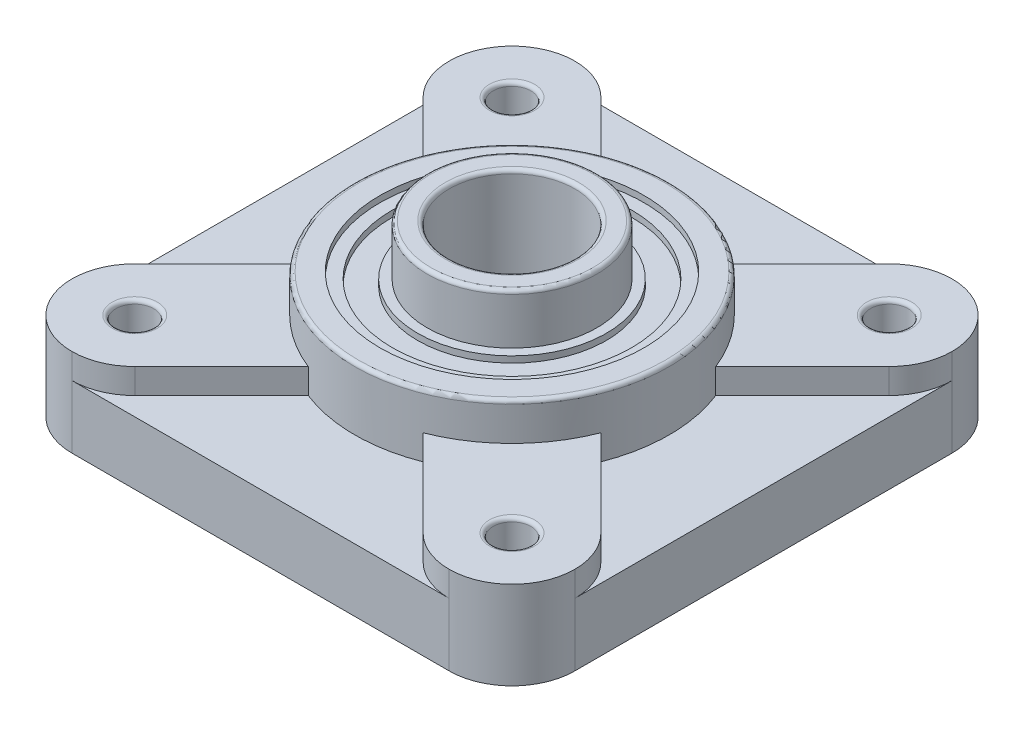
from build123d import *

# Parameters (mm, degrees)
SKETCH1_W           = 40
SKETCH1_H           = 40
SKETCH1_R           = 1.5
BOSS_EXTRUDE1_DEPTH = 5
FILLET1_R           = 5
SKETCH2_R           = 12.5
BOSS_EXTRUDE2_DEPTH = 5
SKETCH3_R           = 10.5
CUT_EXTRUDE1_DEPTH  = 0.5
SKETCH4_R           = 9.5
SKETCH4_R_2         = 7.5
CUT_EXTRUDE2_DEPTH  = 0.5
SKETCH5_R           = 6.75
SKETCH5_R_2         = 5
BOSS_EXTRUDE3_DEPTH = 4
SKETCH6_R           = 5
CUT_EXTRUDE3_DEPTH  = 30.837057496
SKETCH7_R           = 1.5
BOSS_EXTRUDE4_DEPTH = 2
FILLET2_R           = 5
FILLET3_R           = 0.3
FILLET4_R           = 0.3
FILLET5_R           = 0.3


with BuildPart() as part:
    # Sketch1 → Boss-Extrude1 (new body)
    with BuildSketch(Plane(origin=(0, 0, 0), x_dir=(1, 0, 0), z_dir=(0, 1, 0))):
        Rectangle(SKETCH1_W, SKETCH1_H)
        with Locations(Location((-15, 15, 0), (0, 0, 270))):
            Circle(SKETCH1_R, mode=Mode.SUBTRACT)
        with Locations(Location((15, 15, 0), (0, 0, 270))):
            Circle(SKETCH1_R, mode=Mode.SUBTRACT)
        with Locations(Location((15, -15, 0), (0, 0, 270))):
            Circle(SKETCH1_R, mode=Mode.SUBTRACT)
        with Locations(Location((-15, -15, 0), (0, 0, 270))):
            Circle(SKETCH1_R, mode=Mode.SUBTRACT)
    extrude(amount=BOSS_EXTRUDE1_DEPTH)

    # Fillet1
    fillet1_edges = [part.edges().sort_by_distance(p)[0] for p in [
        (20, 2.5, 20),
        (-20, 2.5, 20),
        (-20, 2.5, -20),
        (20, 2.5, -20),
    ]]
    fillet(fillet1_edges, radius=FILLET1_R)

    # Sketch2 → Boss-Extrude2 (add)
    with BuildSketch(Plane(origin=(0, 5, 0), x_dir=(1, 0, 0), z_dir=(0, 1, 0))):
        with Locations(Location((0, 0, 0), (0, 0, 270))):
            Circle(SKETCH2_R)
    extrude(amount=BOSS_EXTRUDE2_DEPTH)

    # Sketch3 → Cut-Extrude1 (cut)
    with BuildSketch(Plane(origin=(0, 10, 0), x_dir=(1, 0, 0), z_dir=(0, 1, 0))):
        with Locations(Location((0, 0, 0), (0, 0, 270))):
            Circle(SKETCH3_R)
    extrude(amount=-CUT_EXTRUDE1_DEPTH, mode=Mode.SUBTRACT)

    # Sketch4 → Cut-Extrude2 (cut)
    with BuildSketch(Plane(origin=(0, 9.5, 0), x_dir=(1, 0, 0), z_dir=(0, 1, 0))):
        with Locations(Location((0, 0, 0), (0, 0, 270))):
            Circle(SKETCH4_R)
        with Locations(Location((0, 0, 0), (0, 0, 270))):
            Circle(SKETCH4_R_2, mode=Mode.SUBTRACT)
    extrude(amount=-CUT_EXTRUDE2_DEPTH, mode=Mode.SUBTRACT)

    # Sketch5 → Boss-Extrude3 (add)
    with BuildSketch(Plane(origin=(0, 9.5, 0), x_dir=(1, 0, 0), z_dir=(0, 1, 0))):
        with Locations(Location((0, 0, 0), (0, 0, 270))):
            Circle(SKETCH5_R)
        with Locations(Location((0, 0, 0), (0, 0, 270))):
            Circle(SKETCH5_R_2, mode=Mode.SUBTRACT)
    extrude(amount=BOSS_EXTRUDE3_DEPTH)

    # Sketch6 → Cut-Extrude3 (cut, through all)
    with BuildSketch(Plane(origin=(0, 9.5, 0), x_dir=(1, 0, 0), z_dir=(0, 1, 0))):
        with Locations(Location((0, 0, 0), (0, 0, 270))):
            Circle(SKETCH6_R)
    extrude(amount=-CUT_EXTRUDE3_DEPTH, mode=Mode.SUBTRACT)

    # Sketch7 → Boss-Extrude4 (add)
    # profile 1 of 5: a face of its own
    with BuildSketch(Plane(origin=(0, 5, 0), x_dir=(1, 0, 0), z_dir=(0, 1, 0))):
        with BuildLine():
            ThreePointArc((-11.636459779, 4.565391967), (-8.838834765, 8.838834765), (-4.565391967, 11.636459779))
            Line((-4.565391967, 11.636459779), (-12.928932188, 20))
            Line((-12.928932188, 20), (-15, 20))
            ThreePointArc((-15, 20), (-18.535533906, 18.535533906), (-20, 15))
            Line((-20, 15), (-20, 12.928932188))
            Line((-20, 12.928932188), (-11.636459779, 4.565391967))
        make_face()
        with Locations(Location((-15, 15, 0), (0, 0, 270))):
            Circle(SKETCH7_R, mode=Mode.SUBTRACT)
    # profile 2 of 5: a face of its own
    with BuildSketch(Plane(origin=(0, 5, 0), x_dir=(1, 0, 0), z_dir=(0, 1, 0))):
        with BuildLine():
            ThreePointArc((4.565391967, 11.636459779), (6.846531969, 10.458250332), (8.838834765, 8.838834765))
            Line((8.838834765, 8.838834765), (13.939339828, 13.939339828))
            ThreePointArc((13.939339828, 13.939339828), (13.939339828, 16.060660172), (16.060660172, 16.060660172))
            Line((16.060660172, 16.060660172), (18.535533906, 18.535533906))
            ThreePointArc((18.535533906, 18.535533906), (16.913417162, 19.619397663), (15, 20))
            Line((15, 20), (12.928932188, 20))
            Line((12.928932188, 20), (4.565391967, 11.636459779))
        make_face()
    # profile 3 of 5: a face of its own
    with BuildSketch(Plane(origin=(0, 5, 0), x_dir=(1, 0, 0), z_dir=(0, 1, 0))):
        with BuildLine():
            ThreePointArc((8.838834765, 8.838834765), (10.458250332, 6.846531969), (11.636459779, 4.565391967))
            Line((11.636459779, 4.565391967), (20, 12.928932188))
            Line((20, 12.928932188), (20, 15))
            ThreePointArc((20, 15), (19.619397663, 16.913417162), (18.535533906, 18.535533906))
            Line((18.535533906, 18.535533906), (16.060660172, 16.060660172))
            ThreePointArc((16.060660172, 16.060660172), (16.385819299, 15.574025149), (16.5, 15))
            ThreePointArc((16.5, 15), (15.574025149, 13.614180701), (13.939339828, 13.939339828))
            Line((13.939339828, 13.939339828), (8.838834765, 8.838834765))
        make_face()
    # profile 4 of 5: a face of its own
    with BuildSketch(Plane(origin=(0, 5, 0), x_dir=(1, 0, 0), z_dir=(0, 1, 0))):
        with BuildLine():
            Line((20, -15), (20, -12.928932188))
            Line((20, -12.928932188), (11.636459779, -4.565391967))
            ThreePointArc((11.636459779, -4.565391967), (8.838834765, -8.838834765), (4.565391967, -11.636459779))
            Line((4.565391967, -11.636459779), (12.928932188, -20))
            Line((12.928932188, -20), (15, -20))
            ThreePointArc((15, -20), (18.535533906, -18.535533906), (20, -15))
        make_face()
        with Locations(Location((15, -15, 0), (0, 0, 270))):
            Circle(SKETCH7_R, mode=Mode.SUBTRACT)
    # profile 5 of 5: a face of its own
    with BuildSketch(Plane(origin=(0, 5, 0), x_dir=(1, 0, 0), z_dir=(0, 1, 0))):
        with BuildLine():
            Line((-12.928932188, -20), (-4.565391967, -11.636459779))
            ThreePointArc((-4.565391967, -11.636459779), (-8.838834765, -8.838834765), (-11.636459779, -4.565391967))
            Line((-11.636459779, -4.565391967), (-20, -12.928932188))
            Line((-20, -12.928932188), (-20, -15))
            ThreePointArc((-20, -15), (-18.535533906, -18.535533906), (-15, -20))
            Line((-15, -20), (-12.928932188, -20))
        make_face()
        with Locations(Location((-15, -15, 0), (0, 0, 270))):
            Circle(SKETCH7_R, mode=Mode.SUBTRACT)
    extrude(amount=BOSS_EXTRUDE4_DEPTH)

    # Fillet2
    fillet2_edges = [part.edges().sort_by_distance(p)[0] for p in [
        (20, 6, -12.928932188),
        (20, 6, 12.928932188),
        (-12.928932188, 6, -20),
        (12.928932188, 6, -20),
        (-20, 6, 12.928932188),
        (12.928932188, 6, 20),
        (-12.928932188, 6, 20),
        (-20, 6, -12.928932188),
    ]]
    fillet(fillet2_edges, radius=FILLET2_R - 0.0001)  # a hair under: the kernel refuses the full size

    # Fillet3
    fillet3_edges = [part.edges().sort_by_distance(p)[0] for p in [
        (13.939339828, 7, -13.939339828),
        (15, 7, 13.5),
        (-15, 7, 13.5),
        (-15, 7, -16.5),
    ]]
    fillet(fillet3_edges, radius=FILLET3_R)

    # Fillet4
    fillet4_edges = [part.edges().sort_by_distance(p)[0] for p in [
        (0, 10, -12.5),
        (0, 13.5, -5),
    ]]
    fillet(fillet4_edges, radius=FILLET4_R)

    # Fillet5
    fillet5_edges = [part.edges().sort_by_distance(p)[0] for p in [
        (0, 13.5, -6.75),
    ]]
    fillet(fillet5_edges, radius=FILLET5_R)


solid = part.part
